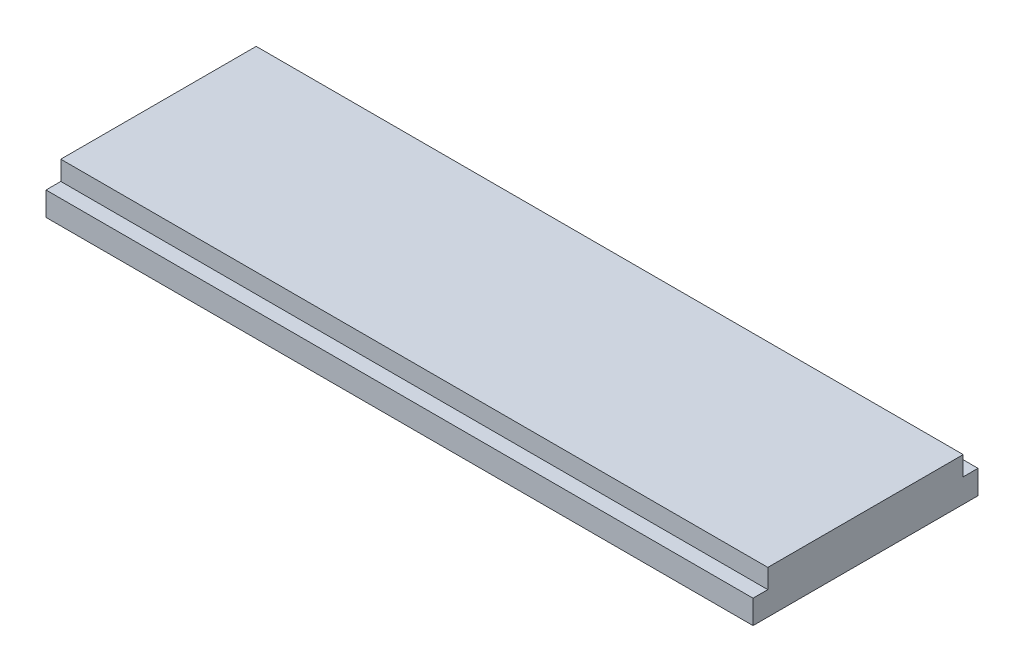
from build123d import *

# Parameters (mm, degrees)
SKETCH1_W           = 1100
SKETCH1_H           = 350
BOSS_EXTRUDE1_DEPTH = 67
SKETCH2_W           = 1100
SKETCH2_H           = 23
CUT_EXTRUDE1_DEPTH  = 30


with BuildPart() as part:
    # Sketch1 → Boss-Extrude1 (new body)
    with BuildSketch(Plane(origin=(0, 0, 0), x_dir=(1, 0, 0), z_dir=(0, 1, 0))):
        with Locations((550, 175)):
            Rectangle(SKETCH1_W, SKETCH1_H)
    extrude(amount=BOSS_EXTRUDE1_DEPTH)

    # Sketch2 → Cut-Extrude1 (cut)
    with BuildSketch(Plane(origin=(0, 67, 0), x_dir=(1, 0, 0), z_dir=(0, 1, 0))):
        with Locations((550, 11.5)):
            Rectangle(SKETCH2_W, SKETCH2_H)
        with Locations((550, 338.5)):
            Rectangle(SKETCH2_W, SKETCH2_H)
    extrude(amount=-CUT_EXTRUDE1_DEPTH, mode=Mode.SUBTRACT)


solid = part.part
